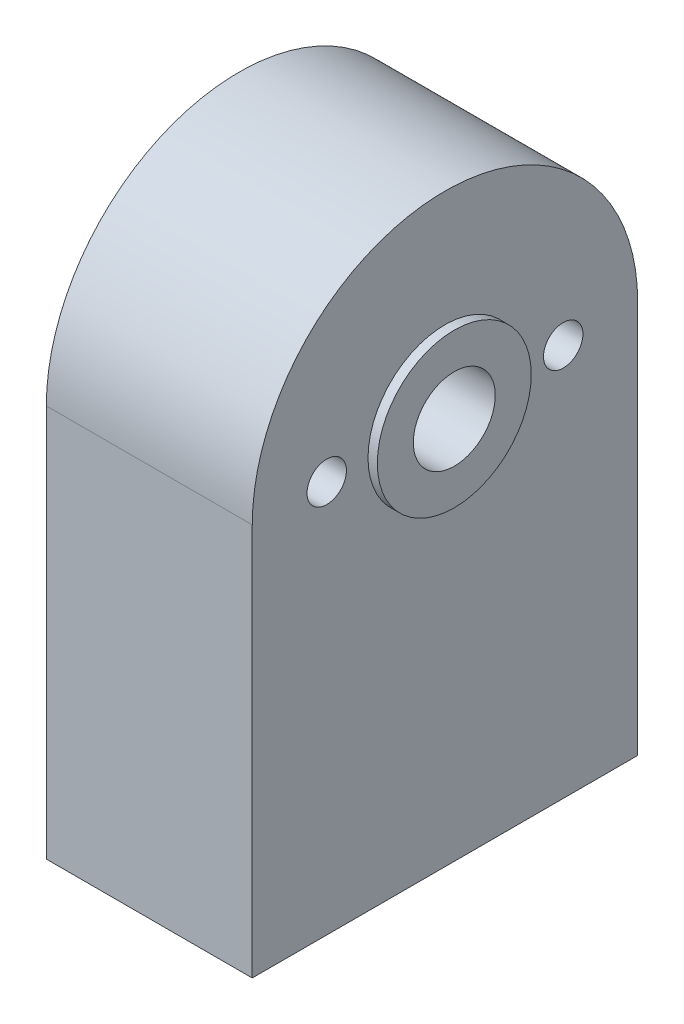
from build123d import *

# Parameters (mm, degrees)
BOSS_EXTRUDE1_DEPTH = 16.59
SKETCH2_R           = 6.2
BOSS_EXTRUDE2_DEPTH = 0.75
SKETCH3_R           = 3.3
SKETCH3_R_2         = 1.5875
CUT_EXTRUDE1_DEPTH  = 40.258240536


with BuildPart() as part:
    # Sketch1 → Boss-Extrude1 (new body)
    with BuildSketch(Plane(origin=(0, 0, 0), x_dir=(0, 0, -1), z_dir=(1, 0, 0))):
        with BuildLine():
            Line((-15.525, -31.615), (15.525, -31.615))
            Line((15.525, -31.615), (15.525, 0))
            ThreePointArc((15.525, 0), (0, 15.525), (-15.525, 0))
            Line((-15.525, 0), (-15.525, -31.615))
        make_face()
    extrude(amount=BOSS_EXTRUDE1_DEPTH)

    # Sketch2 → Boss-Extrude2 (add)
    with BuildSketch(Plane(origin=(16.59, 0, 0), x_dir=(0, 0, -1), z_dir=(1, 0, 0))):
        Circle(SKETCH2_R)
    extrude(amount=BOSS_EXTRUDE2_DEPTH)

    # Sketch3 → Cut-Extrude1 (cut, through all)
    with BuildSketch(Plane(origin=(17.34, 0, 0), x_dir=(0, 0, -1), z_dir=(1, 0, 0))):
        Circle(SKETCH3_R)
        with Locations((-9.525, 0)):
            Circle(SKETCH3_R_2)
        with Locations((9.525, 0)):
            Circle(SKETCH3_R_2)
    extrude(amount=-CUT_EXTRUDE1_DEPTH, mode=Mode.SUBTRACT)


solid = part.part
